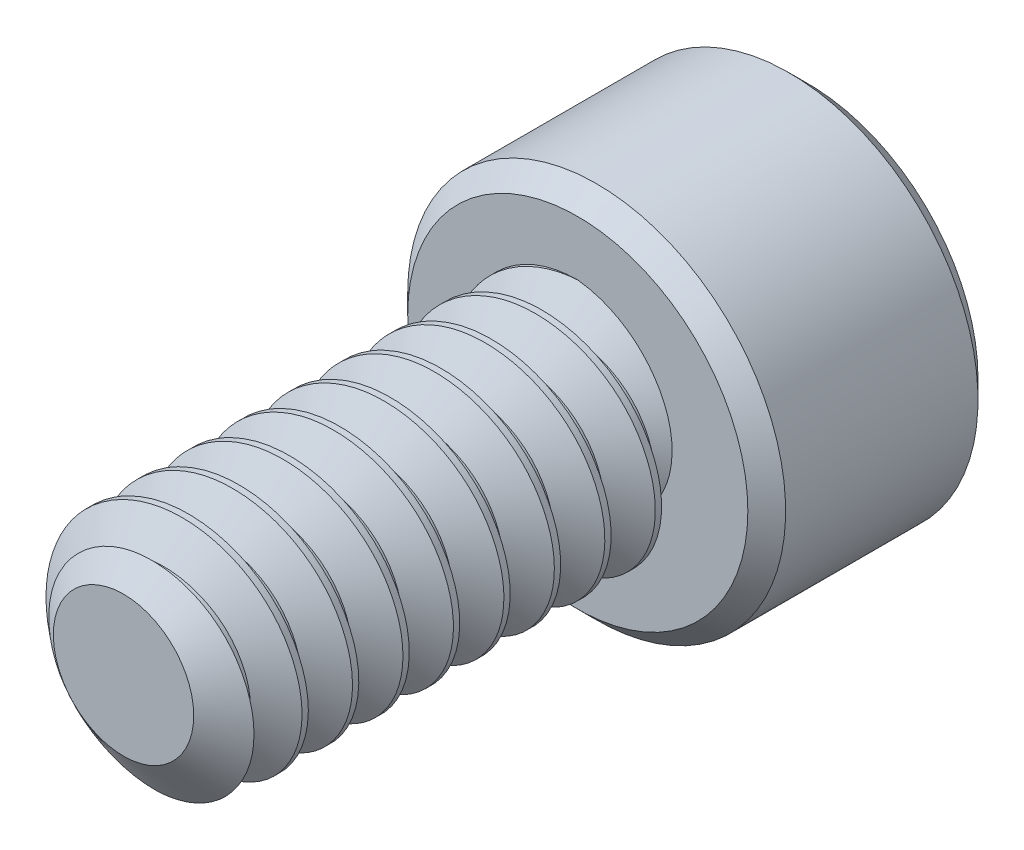
from build123d import *

# Parameters (mm, degrees)
SKETCH1_R          = 2.413
EXTRUDE1_DEPTH     = 9.525
CUT_SWEEP1_PITCH   = 1.058333333
SKETCH6_R          = 3.9624
EXTRUDE2_DEPTH     = 4.826
CUT_EXTRUDE1_DEPTH = 2.9765625
CHAMFER1_SIZE      = 0.39624


with BuildPart() as part:
    # Sketch1 → Extrude1 (new body)
    with BuildSketch(Plane.XY):
        Circle(SKETCH1_R)
    extrude(amount=-EXTRUDE1_DEPTH)

    # Cut-Sweep1: the profile of Sketch3 profile screwed along a right-hand helix of 10 turns, 6 arcs to a turn; built about Z, then put on its axis
    cut_sweep1_z = Axis((0, 0, 0), (0, 0, 1))
    cut_sweep1_corners = [(2.4133, 0, -0.926214872), (1.725592336, 0, -0.529166667), (1.725592336, 0, -0.396875), (2.4133, 0, 0.000173205)]
    with BuildLine(mode=Mode.PRIVATE) as cut_sweep1_profile:
        Line(cut_sweep1_corners[0], cut_sweep1_corners[1])
        Line(cut_sweep1_corners[1], cut_sweep1_corners[2])
        Line(cut_sweep1_corners[2], cut_sweep1_corners[3])
        Line(cut_sweep1_corners[3], cut_sweep1_corners[0])
    cut_sweep1_cap = Face(cut_sweep1_profile.wire())
    cut_sweep1_turn_angles = [0, 30, 60, 90, 120, 150, 180, 210, 240, 270, 300, 330, 360]
    cut_sweep1_turn_weights = [1, 0.8660254037844387, 1, 0.8660254037844387, 1, 0.8660254037844387, 1, 0.8660254037844387, 1, 0.8660254037844387, 1, 0.8660254037844387, 1]
    cut_sweep1_turn_rails = [Edge.make_bspline([Vector(p[0], p[1], 0).rotate(cut_sweep1_z, cut_sweep1_turn_angles[k]) / cut_sweep1_turn_weights[k] + Vector(0, 0, p[2] + CUT_SWEEP1_PITCH * cut_sweep1_turn_angles[k] / 360) for k in range(13)], [0, 0, 0, 1, 1, 2, 2, 3, 3, 4, 4, 5, 5, 6, 6, 6], 2, cut_sweep1_turn_weights) for p in cut_sweep1_corners]
    cut_sweep1_turn_sides = [Face.make_surface_from_curves(cut_sweep1_turn_rails[p[0]], cut_sweep1_turn_rails[p[1]]) for p in [(0, 1), (1, 2), (2, 3), (3, 0)]]
    cut_sweep1 = Plane(origin=(0, 0, 0), x_dir=(0, 1, 0), z_dir=(0, 0, -1)) * Solid(Shell([*[p.moved(Location((0, 0, CUT_SWEEP1_PITCH * i))) for i in range(10) for p in cut_sweep1_turn_sides], cut_sweep1_cap, cut_sweep1_cap.rotate(cut_sweep1_z, 3600).moved(Location((0, 0, CUT_SWEEP1_PITCH * 3600 / 360)))]))
    add(cut_sweep1, mode=Mode.SUBTRACT)

    # Sketch4 → Cut-Revolve1 (revolve, cut)
    with BuildSketch(Plane(origin=(0, 0, 0), x_dir=(0, 0, -1), z_dir=(1, 0, 0)), mode=Mode.PRIVATE) as cut_revolve1_sk:
        Polygon((0.659180743, 2.413), (0, 1.471592336), (0, 2.413), align=None)
    revolve(cut_revolve1_sk.sketch.rotate(Axis((0, 0, 0), (0, 0, -1)), 240.547545651), axis=Axis((0, 0, 0), (0, 0, -1)), mode=Mode.SUBTRACT)

    # Sketch6 → Extrude2 (add)
    with BuildSketch(Plane(origin=(0, 0, -9.525), x_dir=(-1, 0, 0), z_dir=(0, 0, -1))):
        Circle(SKETCH6_R)
    extrude(amount=EXTRUDE2_DEPTH)

    # Sketch7 → Cut-Extrude1 (cut)
    with BuildSketch(Plane(origin=(0, 0, -14.351), x_dir=(-1, 0, 0), z_dir=(0, 0, -1))):
        Polygon((0, 2.291358881), (-1.984375, 1.14567944), (-1.984375, -1.14567944), (0, -2.291358881), (1.984375, -1.14567944), (1.984375, 1.14567944), align=None)
    extrude(amount=-CUT_EXTRUDE1_DEPTH, mode=Mode.SUBTRACT)

    # Cut-Extrude2 cone 1 section (through the dimple's axis) → Cut-Extrude2 (revolve, cut)
    with BuildSketch(Plane(origin=(0, 0, -14.351), x_dir=(0, 1, 0), z_dir=(1, 0, 0))):
        Polygon((0, 0), (2.291358881, 0), (0, 2.291358881), align=None)
    revolve(axis=Axis((0, 0, -14.351), (0, 0, 1)), mode=Mode.SUBTRACT)

    # Chamfer1
    chamfer1_edges = [part.edges().sort_by_distance(p)[0] for p in [
        (3.9624, 0, -9.525),
        (3.9624, 0, -14.351),
    ]]
    chamfer(chamfer1_edges, length=CHAMFER1_SIZE)


solid = part.part
